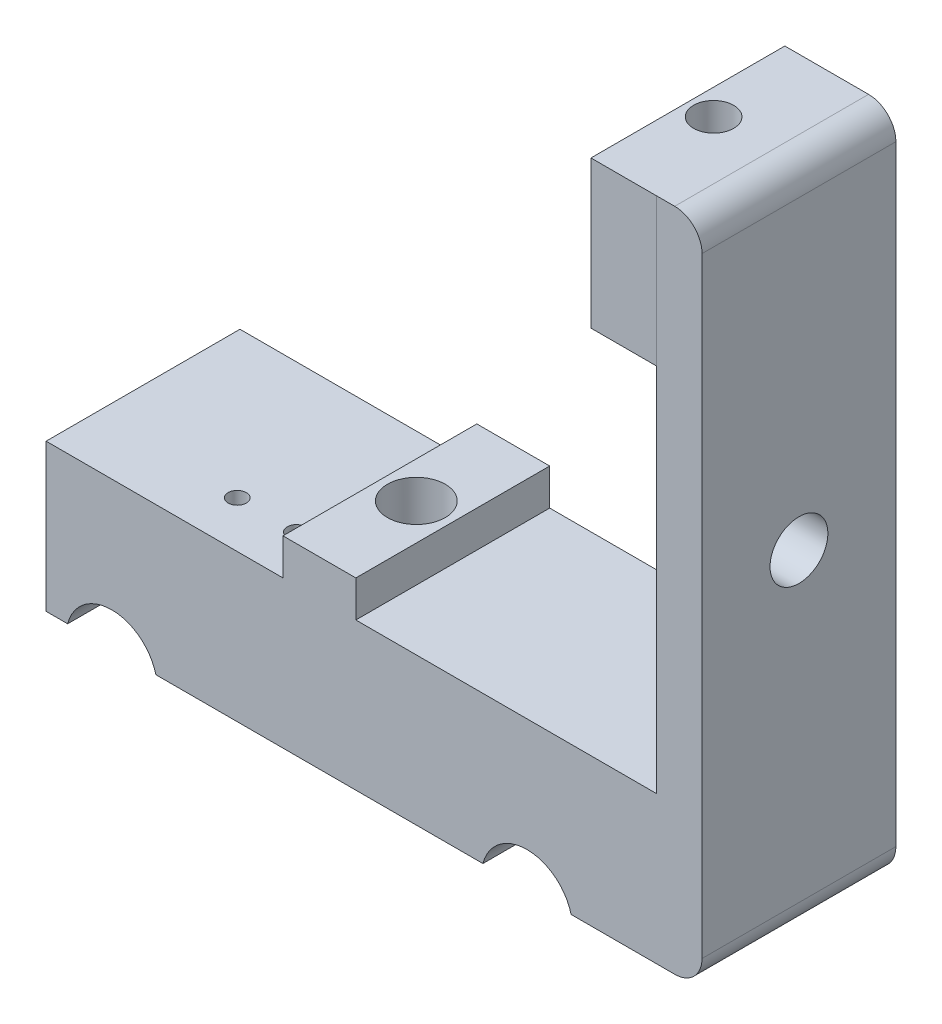
from build123d import *

# Parameters (mm, degrees)
BOSS_EXTRUDE1_DEPTH     = 10.8
BOSS_EXTRUDE2_DEPTH     = 10.64
CUT_EXTRUDE1_DEPTH      = 39.168054705
CUT_EXTRUDE1_DEPTH_BACK = 39.168054705
SKETCH5_R               = 5
FILLET1_R               = 1
SKETCH6_W               = 21.28
SKETCH6_H               = 16.18
BOSS_EXTRUDE3_DEPTH     = 12
SKETCH7_W               = 5
SKETCH7_H               = 21.281328743
BOSS_EXTRUDE4_DEPTH     = 56.83
SKETCH8_W               = 21.284331222
SKETCH8_H               = 16.18
BOSS_EXTRUDE5_DEPTH     = 7.19
FILLET3_R               = 3
SKETCH9_R               = 2.2
CUT_EXTRUDE2_DEPTH      = 85.918196519
SKETCH10_R              = 3.175
CUT_EXTRUDE3_DEPTH      = 85.918196519
SKETCH11_W              = 24.977296572
SKETCH11_H              = 9.721484234
CUT_EXTRUDE4_DEPTH      = 71.220021919
CUT_EXTRUDE5_REACH      = 86.898
SKETCH13_R              = 3.175
CUT_EXTRUDE6_DEPTH      = 90.46728118


with BuildPart() as part:
    # Sketch2 → Boss-Extrude1 (new body)
    with BuildSketch(Plane.XY):
        Polygon((10.1, 0), (10.1, 1.709943763), (6.25480432, 7), (-6.25480432, 7), (-10.1, 1.709943763), (-10.1, 0), align=None)
    extrude(amount=BOSS_EXTRUDE1_DEPTH)

    # Sketch4 → Boss-Extrude2 (add, symmetric)
    with BuildSketch(Plane.XY):
        Polygon((-4, 0), (-4, -4.8), (-30, -4.8), (-30, -20.98), (30, -20.98), (30, -4.8), (4, -4.8), (4, 0), align=None)
    extrude(amount=BOSS_EXTRUDE2_DEPTH, both=True)

    # Sketch5 → Cut-Extrude1 (cut, two sides: drawn at the far end of the back side and taken through both)
    with BuildSketch(Plane.XY.offset(-CUT_EXTRUDE1_DEPTH_BACK)):
        with Locations((-22.790976064, -22.227391232)):
            Circle(SKETCH5_R)
        with Locations((22.790976064, -22.227391232)):
            Circle(SKETCH5_R)
    extrude(amount=CUT_EXTRUDE1_DEPTH + CUT_EXTRUDE1_DEPTH_BACK, mode=Mode.SUBTRACT)

    # Fillet1
    fillet1_edges = [part.edges().sort_by_distance(p)[0] for p in [
        (-10.1, 0, 5.4),
        (-10.1, 1.709943763, 5.4),
        (-6.25480432, 7, 5.4),
        (6.25480432, 7, 5.4),
        (10.1, 0, 5.4),
        (10.1, 1.709943763, 5.4),
    ]]
    fillet(fillet1_edges, radius=FILLET1_R)

    # Sketch6 → Boss-Extrude3 (add)
    with BuildSketch(Plane(origin=(30, 0, 0), x_dir=(0, 0, -1), z_dir=(1, 0, 0))):
        with Locations((0, -12.89)):
            Rectangle(SKETCH6_W, SKETCH6_H)
    extrude(amount=BOSS_EXTRUDE3_DEPTH)

    # Sketch7 → Boss-Extrude4 (add)
    with BuildSketch(Plane(origin=(0, -4.8, 0), x_dir=(1, 0, 0), z_dir=(0, 1, 0))):
        with Locations((39.5, 0.000664372)):
            Rectangle(SKETCH7_W, SKETCH7_H)
    extrude(amount=BOSS_EXTRUDE4_DEPTH)

    # Sketch8 → Boss-Extrude5 (add)
    with BuildSketch(Plane.ZY.offset(-37)):
        with Locations((0.000836868, 43.94)):
            Rectangle(SKETCH8_W, SKETCH8_H)
    extrude(amount=BOSS_EXTRUDE5_DEPTH)

    # Fillet3
    fillet3_edges = [part.edges().sort_by_distance(p)[0] for p in [
        (42, 52.03, -0.000664372),
        (42, -20.98, 0),
    ]]
    fillet(fillet3_edges, radius=FILLET3_R)

    # Sketch9 → Cut-Extrude2 (cut, through all)
    with BuildSketch(Plane.XZ.offset(20.98)):
        with Locations((32.632878078, 0)):
            Circle(SKETCH9_R)
    extrude(amount=-CUT_EXTRUDE2_DEPTH, mode=Mode.SUBTRACT)

    # Sketch10 → Cut-Extrude3 (cut, through all)
    with BuildSketch(Plane.XZ.offset(20.98)):
        with Locations((0.000925951, 0)):
            Circle(SKETCH10_R)
    extrude(amount=-CUT_EXTRUDE3_DEPTH, mode=Mode.SUBTRACT)

    # Sketch11 → Cut-Extrude4 (cut, through all)
    with BuildSketch(Plane.XY.offset(10.8)):
        with Locations((-0.121132817, 4.060742117)):
            Rectangle(SKETCH11_W, SKETCH11_H)
    extrude(amount=-CUT_EXTRUDE4_DEPTH, mode=Mode.SUBTRACT)

    # Sketch12 → Cut-Extrude5 (cut, up to next)
    with BuildSketch(Plane.XZ.offset(20.98), mode=Mode.PRIVATE) as cut_extrude5_sk1:
        with BuildLine():
            ThreePointArc((-8.626172213, 5.53800248), (-7.626172213, 4.53800248), (-6.626172213, 5.53800248))
            ThreePointArc((-6.626172213, 5.53800248), (-7.626172213, 6.53800248), (-8.626172213, 5.53800248))
        make_face()
    cut_extrude5_tool1 = extrude(cut_extrude5_sk1.sketch, amount=-CUT_EXTRUDE5_REACH, mode=Mode.PRIVATE) & part.part
    # Sketch12 → Cut-Extrude5 (cut, up to next)
    with BuildSketch(Plane.XZ.offset(20.98), mode=Mode.PRIVATE) as cut_extrude5_sk2:
        with BuildLine():
            ThreePointArc((-15.126172213, 5.53800248), (-14.126172213, 4.53800248), (-13.126172213, 5.53800248))
            ThreePointArc((-13.126172213, 5.53800248), (-14.126172213, 6.53800248), (-15.126172213, 5.53800248))
        make_face()
    cut_extrude5_tool2 = extrude(cut_extrude5_sk2.sketch, amount=-CUT_EXTRUDE5_REACH, mode=Mode.PRIVATE) & part.part
    add(cut_extrude5_tool1.solids().sort_by_distance((-7.626172, -20.98, 5.538002))[0], mode=Mode.SUBTRACT)
    add(cut_extrude5_tool2.solids().sort_by_distance((-14.126172, -20.98, 5.538002))[0], mode=Mode.SUBTRACT)

    # Sketch13 → Cut-Extrude6 (cut, through all)
    with BuildSketch(Plane(origin=(42, 0, 0), x_dir=(0, 0, -1), z_dir=(1, 0, 0))):
        with Locations((0, 15.525)):
            Circle(SKETCH13_R)
    extrude(amount=-CUT_EXTRUDE6_DEPTH, mode=Mode.SUBTRACT)


solid = part.part
